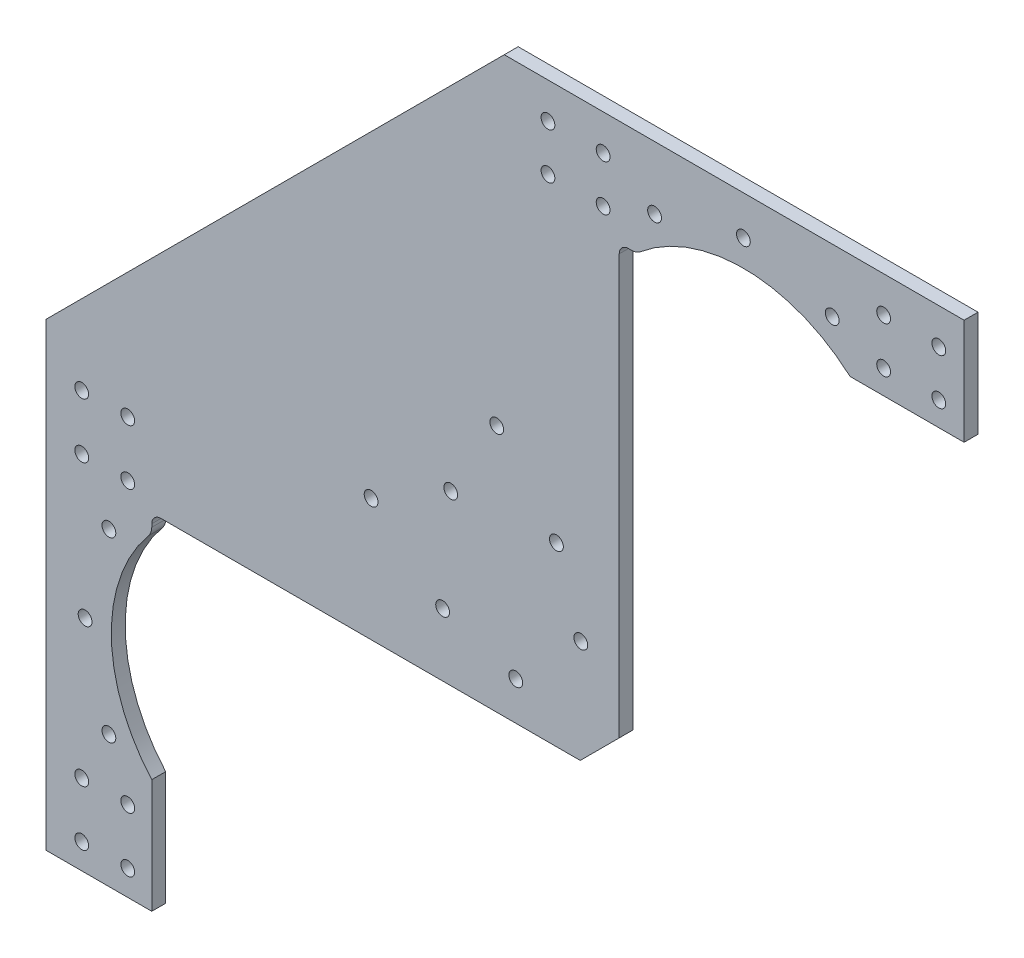
from build123d import *

# Parameters (mm, degrees)
BOSS_EXTRUDE1_DEPTH = 3.0226
SKETCH3_R           = 1.5
CUT_EXTRUDE1_DEPTH  = 10
SKETCH4_R           = 1.5
CUT_EXTRUDE2_DEPTH  = 215.50092613


with BuildPart() as part:
    # Sketch1 → Boss-Extrude1 (new body)
    with BuildSketch(Plane.XY):
        with BuildLine():
            Line((-151.66, -48), (-128.66, -48))
            Line((-128.66, -48), (-128.66, -23.206895527))
            ThreePointArc((-128.66, -23.206895527), (-137.455939504, -0.533121187), (-129.354736842, 22.398060858))
            ThreePointArc((-129.354736842, 22.398060858), (-128.839025924, 23.297059075), (-128.66, 24.317894646))
            Line((-128.66, 24.317894646), (-128.66, 25))
            ThreePointArc((-128.66, 25), (-128.074213562, 26.414213562), (-126.66, 27))
            Line((-126.66, 27), (-35.485281374, 27))
            Line((-35.485281374, 27), (-27, 35.485281374))
            Line((-27, 35.485281374), (-27, 126.66))
            ThreePointArc((-27, 126.66), (-26.414213562, 128.074213562), (-25, 128.66))
            Line((-25, 128.66), (-24.317894646, 128.66))
            ThreePointArc((-24.317894646, 128.66), (-23.297059075, 128.839025924), (-22.398060858, 129.354736842))
            ThreePointArc((-22.398060858, 129.354736842), (0.533121187, 137.455939504), (23.206895527, 128.66))
            Line((23.206895527, 128.66), (48, 128.66))
            Line((48, 128.66), (48, 151.66))
            Line((48, 151.66), (-52, 151.66))
            Line((-52, 151.66), (-151.66, 52))
            Line((-151.66, 52), (-151.66, -48))
        make_face()
    extrude(amount=BOSS_EXTRUDE1_DEPTH)

    # Sketch3 → Cut-Extrude1 (cut)
    with BuildSketch(Plane.XY.offset(3.0226)):
        with Locations((30.5, 133.88592343)):
            Circle(SKETCH3_R)
        with Locations((30.5, 143.88592343)):
            Circle(SKETCH3_R)
        with Locations((42.5, 143.88592343)):
            Circle(SKETCH3_R)
        with Locations((42.5, 133.88592343)):
            Circle(SKETCH3_R)
        with Locations((-42.5, 133.88592343)):
            Circle(SKETCH3_R)
        with Locations((-42.5, 143.88592343)):
            Circle(SKETCH3_R)
        with Locations((-30.5, 143.88592343)):
            Circle(SKETCH3_R)
        with Locations((-30.5, 133.88592343)):
            Circle(SKETCH3_R)
        with Locations((-143.88592343, 30.5)):
            Circle(SKETCH3_R)
        with Locations((-143.88592343, 42.5)):
            Circle(SKETCH3_R)
        with Locations((-133.88592343, 42.5)):
            Circle(SKETCH3_R)
        with Locations((-133.88592343, 30.5)):
            Circle(SKETCH3_R)
        with Locations((-143.88592343, -42.5)):
            Circle(SKETCH3_R)
        with Locations((-143.88592343, -30.5)):
            Circle(SKETCH3_R)
        with Locations((-133.88592343, -30.5)):
            Circle(SKETCH3_R)
        with Locations((-133.88592343, -42.5)):
            Circle(SKETCH3_R)
    extrude(amount=-CUT_EXTRUDE1_DEPTH, mode=Mode.SUBTRACT)

    # Sketch4 → Cut-Extrude2 (cut, through all)
    with BuildSketch(Plane.XY.offset(3.0226)):
        with Locations((-143.16, 0)):
            Circle(SKETCH4_R)
        with Locations((-63.639610307, 63.639610307)):
            Circle(SKETCH4_R)
        with Locations((0, 143.16)):
            Circle(SKETCH4_R)
        with Locations((-80.960118382, 53.639610307)):
            Circle(SKETCH4_R)
        with Locations((-53.639610307, 80.960118382)):
            Circle(SKETCH4_R)
        with Locations((19.318516526, 137.983619098)):
            Circle(SKETCH4_R)
        with Locations((-19.318516526, 137.983619098)):
            Circle(SKETCH4_R)
        with Locations((-137.983619098, 19.318516526)):
            Circle(SKETCH4_R)
        with Locations((-137.983619098, -19.318516526)):
            Circle(SKETCH4_R)
        with Locations((-40.658639918, 65.40737726)):
            Circle(SKETCH4_R)
        with Locations((-65.40737726, 40.658639918)):
            Circle(SKETCH4_R)
        with Locations((-49.497474683, 35.355339059)):
            Circle(SKETCH4_R)
        with Locations((-35.355339059, 49.497474683)):
            Circle(SKETCH4_R)
    extrude(amount=-CUT_EXTRUDE2_DEPTH, mode=Mode.SUBTRACT)


solid = part.part
